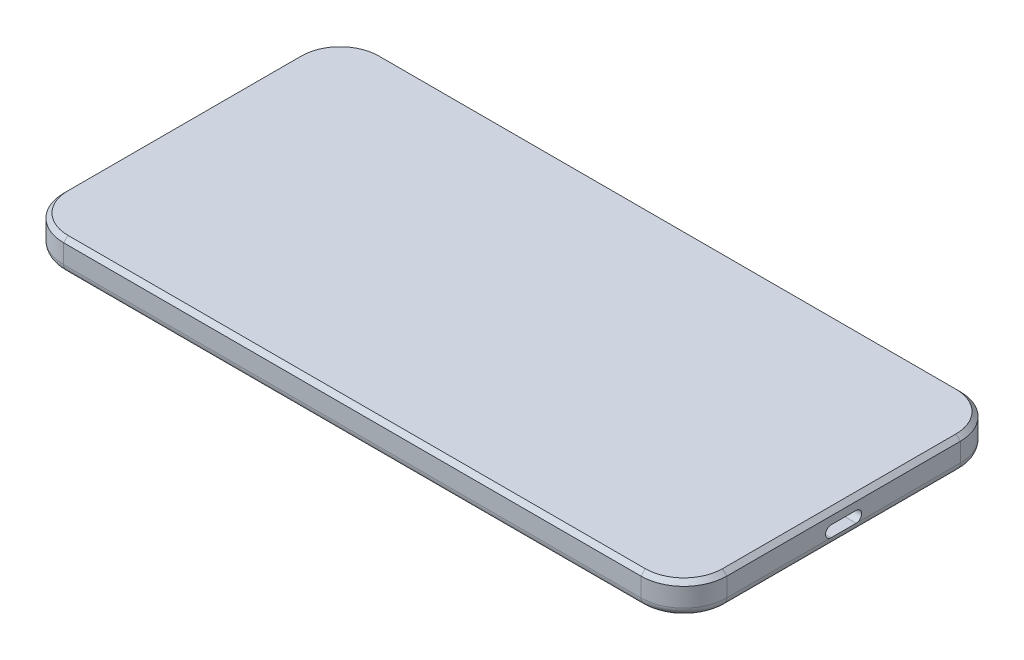
from build123d import *

# Parameters (mm, degrees)
SKETCH1_W           = 154.5
SKETCH1_H           = 74.4
BOSS_EXTRUDE1_DEPTH = 7.4
FILLET1_R           = 10
CHAMFER1_SIZE       = 1
FILLET2_R           = 2
BOSS_EXTRUDE2_DEPTH = 0.6
CHAMFER2_SIZE       = 0.3
CUT_EXTRUDE1_DEPTH  = 6.75


with BuildPart() as part:
    # Sketch1 → Boss-Extrude1 (new body)
    with BuildSketch(Plane(origin=(0, 0, 0), x_dir=(1, 0, 0), z_dir=(0, 1, 0))):
        Rectangle(SKETCH1_W, SKETCH1_H)
    extrude(amount=BOSS_EXTRUDE1_DEPTH)

    # Fillet1
    fillet1_edges = [part.edges().sort_by_distance(p)[0] for p in [
        (-77.25, 3.7, -37.2),
        (77.25, 3.7, -37.2),
        (-77.25, 3.7, 37.2),
        (77.25, 3.7, 37.2),
    ]]
    fillet(fillet1_edges, radius=FILLET1_R)

    # Chamfer1
    chamfer1_edges = [part.edges().sort_by_distance(p)[0] for p in [
        (0, 7.4, 37.2),
        (74.321067812, 7.4, 34.271067812),
        (-74.321067812, 7.4, 34.271067812),
        (77.25, 7.4, 0),
        (-77.25, 7.4, 0),
        (74.321067812, 7.4, -34.271067812),
        (-74.321067812, 7.4, -34.271067812),
        (0, 7.4, -37.2),
    ]]
    chamfer(chamfer1_edges, length=CHAMFER1_SIZE)

    # Fillet2
    fillet2_edges = [part.edges().sort_by_distance(p)[0] for p in [
        (74.321067812, 0, -34.271067812),
        (77.25, 0, 0),
        (74.321067812, 0, 34.271067812),
        (0, 0, 37.2),
        (-74.321067812, 0, 34.271067812),
        (-77.25, 0, 0),
        (-74.321067812, 0, -34.271067812),
        (0, 0, -37.2),
    ]]
    fillet(fillet2_edges, radius=FILLET2_R)

    # Sketch2 → Boss-Extrude2 (add)
    with BuildSketch(Plane.XZ):
        with BuildLine():
            Line((-73.25, -13.75), (-73.25, -23.65))
            ThreePointArc((-73.25, -23.65), (-68.95, -27.95), (-64.65, -23.65))
            Line((-64.65, -23.65), (-64.65, -13.75))
            ThreePointArc((-64.65, -13.75), (-68.95, -9.45), (-73.25, -13.75))
        make_face()
    extrude(amount=BOSS_EXTRUDE2_DEPTH)

    # Chamfer2
    chamfer2_edges = [part.edges().sort_by_distance(p)[0] for p in [
        (-64.65, -0.6, -18.7),
        (-68.95, -0.6, -27.95),
        (-68.95, -0.6, -9.45),
        (-73.25, -0.6, -18.7),
    ]]
    chamfer(chamfer2_edges, length=CHAMFER2_SIZE)

    # Sketch3 → Cut-Extrude1 (cut)
    with BuildSketch(Plane(origin=(77.25, 0, 0), x_dir=(0, 0, -1), z_dir=(1, 0, 0))):
        with BuildLine():
            Line((-2.9, 4.6), (2.9, 4.6))
            ThreePointArc((2.9, 4.6), (4.2, 3.3), (2.9, 2))
            Line((2.9, 2), (-2.9, 2))
            ThreePointArc((-2.9, 2), (-4.2, 3.3), (-2.9, 4.6))
        make_face()
    extrude(amount=-CUT_EXTRUDE1_DEPTH, mode=Mode.SUBTRACT)


solid = part.part
